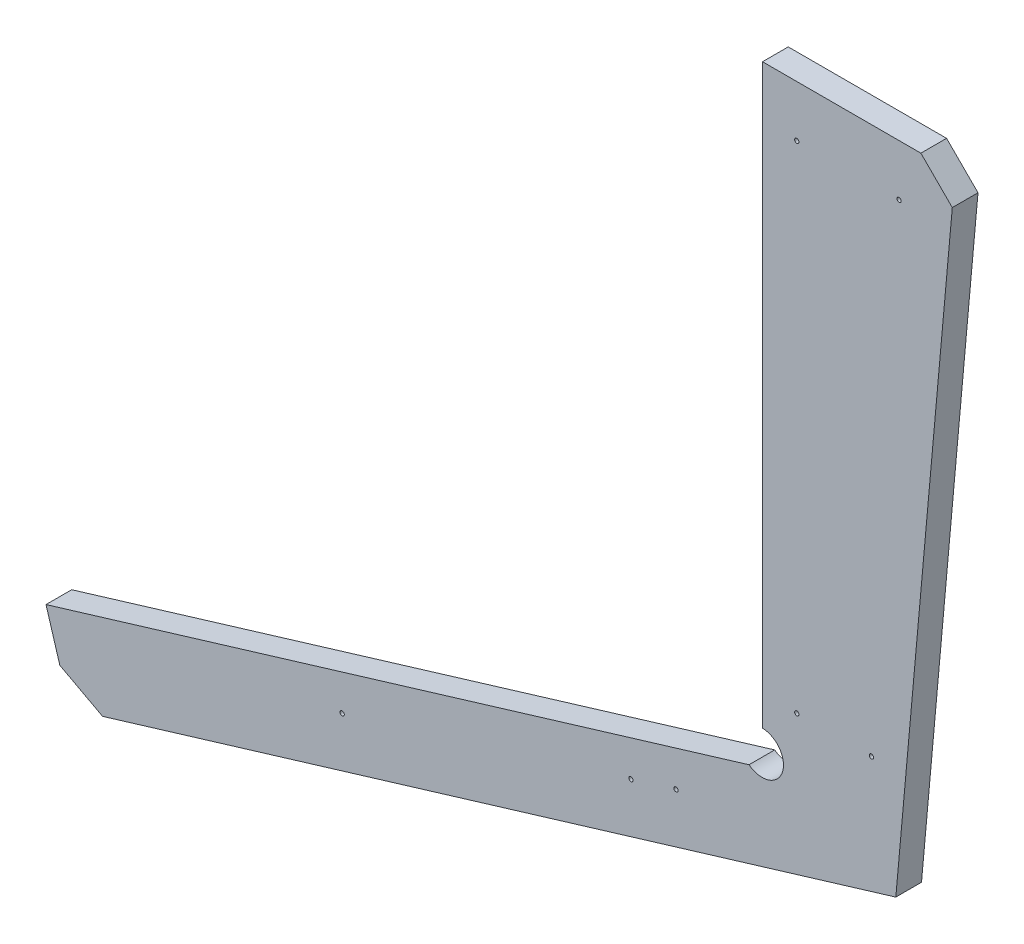
from build123d import *
from OCP.BRepFilletAPI import BRepFilletAPI_MakeChamfer

# Parameters (mm, degrees)
BOSS_EXTRUDE1_DEPTH = 19.05
CHAMFER1_SIZE       = 25.4
CHAMFER1_SIZE2      = 23.3906272
HOLE5_D             = 3.175
HOLE5_DEPTH         = 38.1
HOLE5_CSINK_D       = 10.16
HOLE5_CSINK_ANGLE   = 82
HOLE5_TIP           = 0.953866233
HOLE6_D             = 3.175
HOLE6_DEPTH         = 38.1
HOLE6_CSINK_D       = 10.16
HOLE6_CSINK_ANGLE   = 82
HOLE6_TIP           = 0.953866233


with BuildPart() as part:
    # Sketch1 → Boss-Extrude1 (new body)
    with BuildSketch(Plane.XY):
        with BuildLine():
            Line((12.7, 12.7), (12.7, -415.185594934))
            ThreePointArc((12.7, -415.185594934), (27.339445595, -436.32629993), (2.687239133, -443.641454859))
            Line((2.687239133, -443.641454859), (-518.461959982, -601.369999539))
            Line((-518.461959982, -601.369999539), (-500.854245583, -659.547460543))
            Line((-500.854245583, -659.547460543), (111.511572204, -474.211726716))
            Line((111.511572204, -474.211726716), (155.492294041, 12.7))
            Line((155.492294041, 12.7), (12.7, 12.7))
        make_face()
    extrude(amount=-BOSS_EXTRUDE1_DEPTH)

    # Chamfer1: one chamfer whose edges measure the first distance from different faces: ONE call of the kernel's chamfer builder (chamfer() names one face for all edges)
    chamfer1_edges_1 = [part.edges().sort_by_distance(p)[0] for p in [
        (-500.854245583, -659.547460543, -9.525),
    ]]
    chamfer1_edges_2 = [part.edges().sort_by_distance(p)[0] for p in [
        (155.492294041, 12.7, -9.525),
    ]]
    chamfer1_side_2 = [part.faces().sort_by_distance(p)[0] for p in [
        (84.09614702, 12.7, -9.525),
    ]]
    chamfer1 = BRepFilletAPI_MakeChamfer(part.part.solid().wrapped)
    for e in chamfer1_edges_1:
        chamfer1.Add(CHAMFER1_SIZE, e.wrapped)
    for e in chamfer1_edges_2:
        chamfer1.Add(CHAMFER1_SIZE, CHAMFER1_SIZE2, e.wrapped, chamfer1_side_2[0].wrapped)  # the first distance lies on this face
    add(Compound.cast(chamfer1.Shape()), mode=Mode.REPLACE)

    # Hole5
    with Locations(Plane(origin=(155.286738577, 10.424290059, -19.05), x_dir=(-0.08995962873759064, -0.9959454127598535, 0), z_dir=(0, 0, -1))):
        with Locations((46.221112845, 113.488854888), (39.39759596, 37.945520226), (412.28786892, 80.423559293), (407.308516105, 25.297013484), (513.561319184, 161.164706775), (597.46020397, 127.267357003), (610.543339245, 159.649253123), (694.322923815, 367.011001477), (526.644454459, 193.546602895), (610.424039029, 400.908351249)):
            CounterSinkHole(HOLE5_D / 2, HOLE5_CSINK_D / 2, depth=HOLE5_DEPTH, counter_sink_angle=HOLE5_CSINK_ANGLE)
            with Locations((0, 0, -(HOLE5_DEPTH + HOLE5_TIP / 2))):  # 118° drill point
                Cone(0, HOLE5_D / 2, HOLE5_TIP, mode=Mode.SUBTRACT)

    # Hole6
    with Locations(Plane(origin=(-643.705760022, -231.394989772, 165.474999994), x_dir=(0, 0, -1), z_dir=(-0.9571239768071421, -0.2896786029738502, -1.2569443472852944e-15))):
        with Locations((-108.649999997, 332.89193461), (108.649999997, 332.89193461), (207.774999994, 332.89193461), (174.999999994, 448.336332751), (135.266666663, 384.042401694), (176.283333328, 384.042401694), (-174.999999994, 448.336332751), (-135.266666663, 384.042401694), (-176.283333328, 384.042401694), (-207.774999994, 332.89193461)):
            CounterSinkHole(HOLE6_D / 2, HOLE6_CSINK_D / 2, depth=HOLE6_DEPTH, counter_sink_angle=HOLE6_CSINK_ANGLE)
            with Locations((0, 0, -(HOLE6_DEPTH + HOLE6_TIP / 2))):  # 118° drill point
                Cone(0, HOLE6_D / 2, HOLE6_TIP, mode=Mode.SUBTRACT)


solid = part.part
